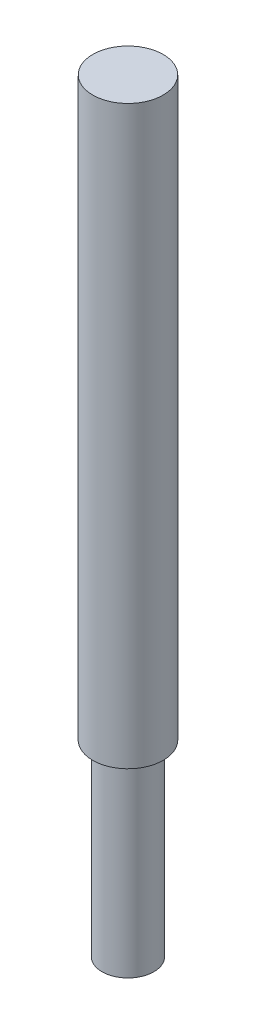
from build123d import *

# Parameters (mm, degrees)
SKETCH1_R           = 2.38125
BOSS_EXTRUDE1_DEPTH = 38.9763
SKETCH2_R           = 1.7526
BOSS_EXTRUDE2_DEPTH = 12.7


with BuildPart() as part:
    # Sketch1 → Boss-Extrude1 (new body)
    with BuildSketch(Plane(origin=(0, 0, 0), x_dir=(1, 0, 0), z_dir=(0, 1, 0))):
        Circle(SKETCH1_R)
    extrude(amount=BOSS_EXTRUDE1_DEPTH)

    # Sketch2 → Boss-Extrude2 (add)
    with BuildSketch(Plane.XZ):
        Circle(SKETCH2_R)
    extrude(amount=BOSS_EXTRUDE2_DEPTH)


solid = part.part
